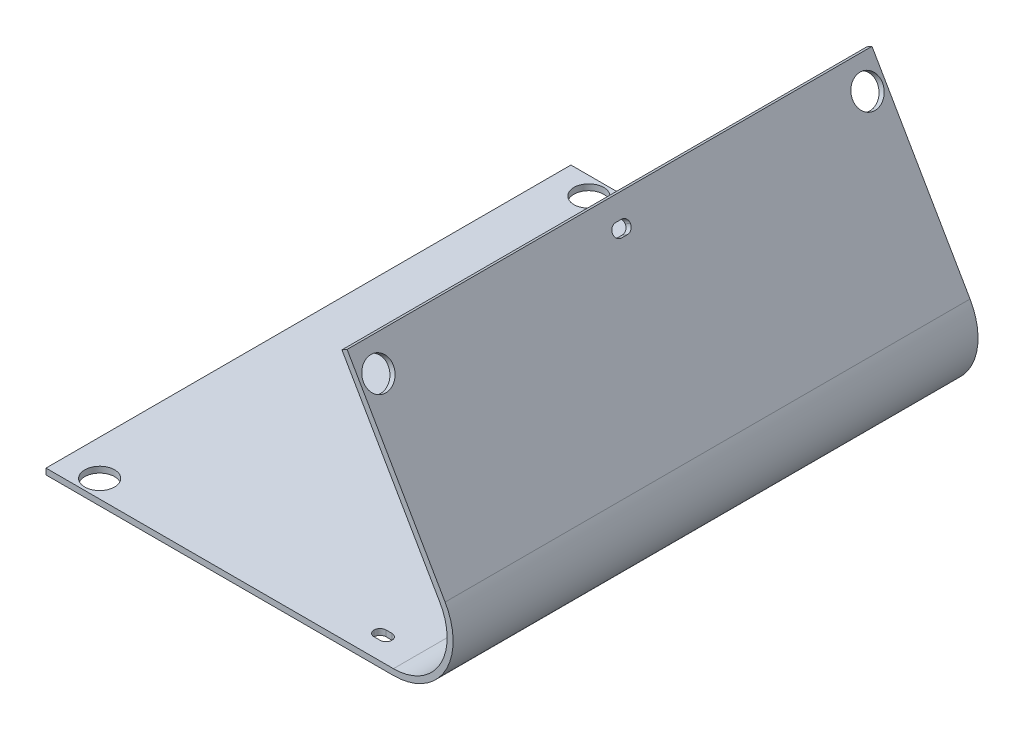
from build123d import *

# Parameters (mm, degrees)
BASE_DEPTH                 = 88
SZKIC3_R                   = 2.5
HOLES_DEPTH                = 106.252783529
WYTNIJ_WYCI_GNI_CIE1_REACH = 107.253
SZKIC6_W                   = 3
SZKIC6_H                   = 2
WYTNIJ_WYCI_GNI_CIE3_REACH = 112.877
SZKIC7_R                   = 2.5
WYTNIJ_WYCI_GNI_CIE4_REACH = 112.877
SZKIC8_W                   = 3
SZKIC8_H                   = 2
ZAOKR_GLENIE1_R            = 1


with BuildPart() as part:
    # Szkic1 → base (new body)
    with BuildSketch(Plane.XY):
        with BuildLine():
            Line((-29.125, 0), (29.125, 0))
            ThreePointArc((29.125, 0), (37.785254038, 5), (37.785254038, 15))
            Line((37.785254038, 15), (21.350254038, 43.466255022))
            Line((21.350254038, 43.466255022), (20.484228634, 42.966255022))
            Line((20.484228634, 42.966255022), (36.919228634, 14.5))
            ThreePointArc((36.919228634, 14.5), (36.919228634, 5.5), (29.125, 1))
            Line((29.125, 1), (-29.125, 1))
            Line((-29.125, 1), (-29.125, 0))
        make_face()
    extrude(amount=BASE_DEPTH)

    # Szkic3 → holes (cut, through all)
    with BuildSketch(Plane(origin=(0, 1, 0), x_dir=(1, 0, 0), z_dir=(0, 1, 0))):
        with Locations(Location((-23.125, -3, 0), (0, 0, 270))):
            Circle(SZKIC3_R)
        with Locations(Location((-23.125, -85, 0), (0, 0, 90))):
            Circle(SZKIC3_R)
    extrude(amount=-HOLES_DEPTH, mode=Mode.SUBTRACT)

    # Szkic6 → Wytnij-wyciągnięcie1 (cut, up to next)
    with BuildSketch(Plane(origin=(0, 1, 0), x_dir=(1, 0, 0), z_dir=(0, 1, 0)), mode=Mode.PRIVATE) as wytnij_wyci_gni_cie1_sk1:
        with Locations((23.375, -84)):
            Rectangle(SZKIC6_W, SZKIC6_H)
    wytnij_wyci_gni_cie1_tool1 = extrude(wytnij_wyci_gni_cie1_sk1.sketch, amount=-WYTNIJ_WYCI_GNI_CIE1_REACH, mode=Mode.PRIVATE) & part.part
    # Szkic6 → Wytnij-wyciągnięcie1 (cut, up to next)
    with BuildSketch(Plane(origin=(0, 1, 0), x_dir=(1, 0, 0), z_dir=(0, 1, 0)), mode=Mode.PRIVATE) as wytnij_wyci_gni_cie1_sk2:
        with Locations((23.375, -4)):
            Rectangle(SZKIC6_W, SZKIC6_H)
    wytnij_wyci_gni_cie1_tool2 = extrude(wytnij_wyci_gni_cie1_sk2.sketch, amount=-WYTNIJ_WYCI_GNI_CIE1_REACH, mode=Mode.PRIVATE) & part.part
    add(wytnij_wyci_gni_cie1_tool1.solids().sort_by_distance((23.375, 1, 84))[0], mode=Mode.SUBTRACT)
    add(wytnij_wyci_gni_cie1_tool2.solids().sort_by_distance((23.375, 1, 4))[0], mode=Mode.SUBTRACT)

    # Szkic7 → Wytnij-wyciągnięcie3 (cut, up to next)
    with BuildSketch(Plane(origin=(33.968105653, 19.611494943, 0), x_dir=(0, 0, 1), z_dir=(-0.8660254037844387, -0.5000000000000001, 0)), mode=Mode.PRIVATE) as wytnij_wyci_gni_cie3_sk1:
        with Locations(Location((85, 22.464423789, 0), (0, 0, 270))):
            Circle(SZKIC7_R)
    wytnij_wyci_gni_cie3_tool1 = extrude(wytnij_wyci_gni_cie3_sk1.sketch, amount=-WYTNIJ_WYCI_GNI_CIE3_REACH, mode=Mode.PRIVATE) & part.part
    # Szkic7 → Wytnij-wyciągnięcie3 (cut, up to next)
    with BuildSketch(Plane(origin=(33.968105653, 19.611494943, 0), x_dir=(0, 0, 1), z_dir=(-0.8660254037844387, -0.5000000000000001, 0)), mode=Mode.PRIVATE) as wytnij_wyci_gni_cie3_sk2:
        with Locations(Location((3, 22.464423789, 0), (0, 0, 270))):
            Circle(SZKIC7_R)
    wytnij_wyci_gni_cie3_tool2 = extrude(wytnij_wyci_gni_cie3_sk2.sketch, amount=-WYTNIJ_WYCI_GNI_CIE3_REACH, mode=Mode.PRIVATE) & part.part
    add(wytnij_wyci_gni_cie3_tool1.solids().sort_by_distance((22.735894, 39.066257, 85))[0], mode=Mode.SUBTRACT)
    add(wytnij_wyci_gni_cie3_tool2.solids().sort_by_distance((22.735894, 39.066257, 3))[0], mode=Mode.SUBTRACT)

    # Szkic8 → Wytnij-wyciągnięcie4 (cut, up to next)
    with BuildSketch(Plane(origin=(33.968105653, 19.611494943, 0), x_dir=(0, 0, 1), z_dir=(-0.8660254037844387, -0.5000000000000001, 0)), mode=Mode.PRIVATE) as wytnij_wyci_gni_cie4_sk1:
        with Locations((44, 22.967754038)):
            Rectangle(SZKIC8_W, SZKIC8_H)
    wytnij_wyci_gni_cie4_tool1 = extrude(wytnij_wyci_gni_cie4_sk1.sketch, amount=-WYTNIJ_WYCI_GNI_CIE4_REACH, mode=Mode.PRIVATE) & part.part
    add(wytnij_wyci_gni_cie4_tool1.solids().sort_by_distance((22.484229, 39.502153, 44))[0], mode=Mode.SUBTRACT)

    # Zaokrąglenie1
    zaokr_glenie1_edges = [part.edges().sort_by_distance(p)[0] for p in [
        (22.417241336, 40.618178811, 42.5),
        (23.417241336, 38.886128003, 42.5),
        (22.417241336, 40.618178811, 45.5),
        (23.417241336, 38.886128003, 45.5),
        (21.875, 0.5, 85),
        (24.875, 0.5, 83),
        (24.875, 0.5, 85),
        (21.875, 0.5, 83),
        (21.875, 0.5, 3),
        (21.875, 0.5, 5),
        (24.875, 0.5, 3),
        (24.875, 0.5, 5),
    ]]
    fillet(zaokr_glenie1_edges, radius=ZAOKR_GLENIE1_R - 0.0001)  # a hair under: the kernel refuses the full size


solid = part.part
